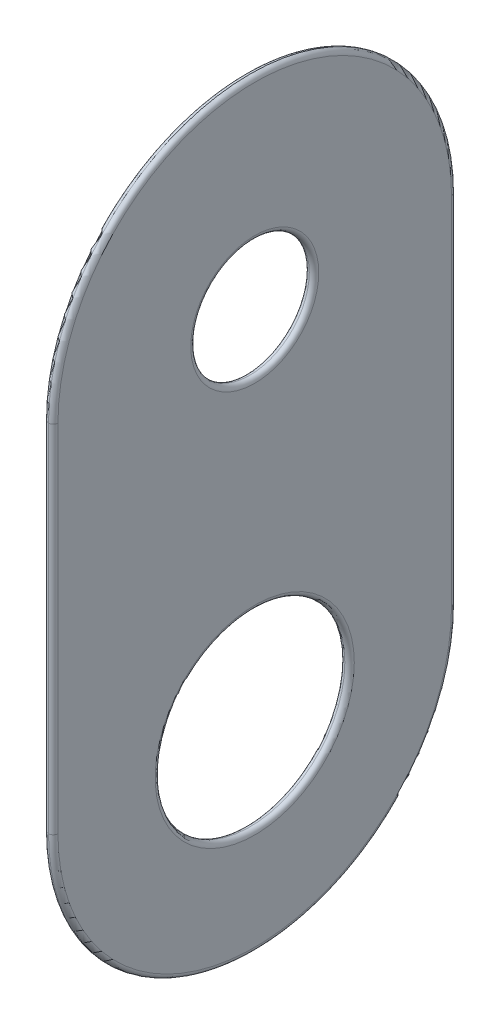
from build123d import *

# Parameters (mm, degrees)
SKETCH2_R           = 3.175
SKETCH2_R_2         = 5.08
BOSS_EXTRUDE1_DEPTH = 0.254
FILLET1_R           = 0.254
FILLET2_R           = 0.254


with BuildPart() as part:
    # Sketch2 → Boss-Extrude1 (new, symmetric)
    with BuildSketch(Plane(origin=(0, 0, 0), x_dir=(0, 0, -1), z_dir=(1, 0, 0))):
        with BuildLine():
            Line((10.795, 9.525), (10.795, -9.525))
            ThreePointArc((10.795, -9.525), (0, -20.32), (-10.795, -9.525))
            Line((-10.795, -9.525), (-10.795, 9.525))
            ThreePointArc((-10.795, 9.525), (0, 20.32), (10.795, 9.525))
        make_face()
        with Locations((0, 9.525)):
            Circle(SKETCH2_R, mode=Mode.SUBTRACT)
        with Locations((0, -9.525)):
            Circle(SKETCH2_R_2, mode=Mode.SUBTRACT)
    extrude(amount=BOSS_EXTRUDE1_DEPTH, both=True)

    # Fillet1
    fillet1_edges = [part.edges().sort_by_distance(p)[0] for p in [
        (0.254, -20.32, 0),
        (0.254, 9.525, 3.175),
        (0.254, 0, -10.795),
        (0.254, -9.525, 5.08),
        (0.254, 20.32, 0),
        (0.254, 0, 10.795),
    ]]
    fillet(fillet1_edges, radius=FILLET1_R)

    # Fillet2
    fillet2_edges = [part.edges().sort_by_distance(p)[0] for p in [
        (-0.254, -9.525, 5.08),
        (-0.254, 9.525, 3.175),
        (-0.254, 0, 10.795),
        (-0.254, -20.32, 0),
        (-0.254, 0, -10.795),
        (-0.254, 20.32, 0),
    ]]
    fillet(fillet2_edges, radius=FILLET2_R - 0.0001)  # a hair under: the kernel refuses the full size


solid = part.part
